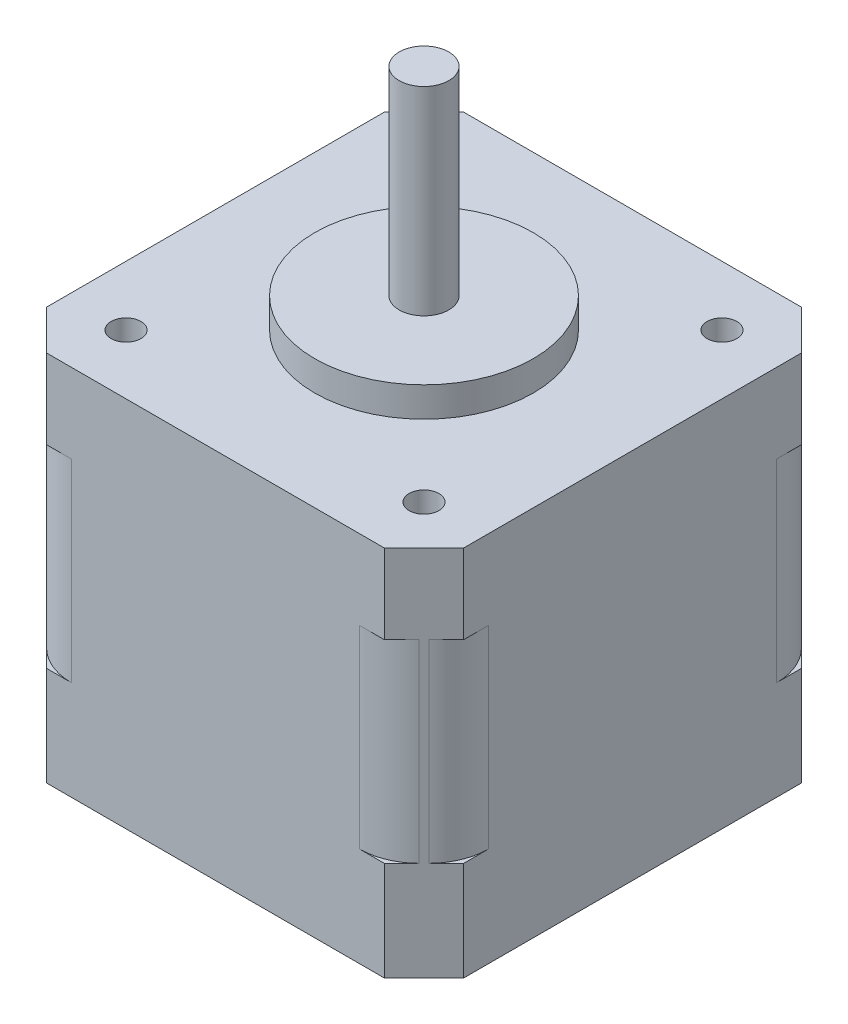
from build123d import *

# Parameters (mm, degrees)
SKETCH1_W           = 42
SKETCH1_H           = 42
BOSS_EXTRUDE1_DEPTH = 37.5
SKETCH2_R           = 2.5
BOSS_EXTRUDE2_DEPTH = 23
SKETCH3_R           = 1.5
CUT_EXTRUDE1_DEPTH  = 8
SKETCH4_R           = 11
BOSS_EXTRUDE3_DEPTH = 3
CHAMFER1_SIZE       = 4
SKETCH5_W           = 18
SKETCH5_H           = 10
BOSS_EXTRUDE4_DEPTH = 6
FILLET1_START       = 10
FILLET1_DEPTH       = 19.5
FILLET2_START       = 10
FILLET2_DEPTH       = 19.5
FILLET3_START       = 10
FILLET3_DEPTH       = 19.5


with BuildPart() as part:
    # Sketch1 → Boss-Extrude1 (new body)
    with BuildSketch(Plane(origin=(0, 0, 0), x_dir=(1, 0, 0), z_dir=(0, 1, 0))):
        with Locations((21, 21)):
            Rectangle(SKETCH1_W, SKETCH1_H)
    extrude(amount=BOSS_EXTRUDE1_DEPTH)

    # Sketch2 → Boss-Extrude2 (add)
    with BuildSketch(Plane(origin=(0, 37.5, 0), x_dir=(1, 0, 0), z_dir=(0, 1, 0))):
        with Locations(Location((21, 21, 0), (0, 0, 90))):
            Circle(SKETCH2_R)
    extrude(amount=BOSS_EXTRUDE2_DEPTH)

    # Sketch3 → Cut-Extrude1 (cut)
    with BuildSketch(Plane(origin=(0, 37.5, 0), x_dir=(1, 0, 0), z_dir=(0, 1, 0))):
        with Locations(Location((6, 36, 0), (0, 0, 270))):
            Circle(SKETCH3_R)
        with Locations(Location((36, 36, 0), (0, 0, 270))):
            Circle(SKETCH3_R)
        with Locations(Location((36, 6, 0), (0, 0, 270))):
            Circle(SKETCH3_R)
        with Locations(Location((6, 6, 0), (0, 0, 270))):
            Circle(SKETCH3_R)
    extrude(amount=-CUT_EXTRUDE1_DEPTH, mode=Mode.SUBTRACT)

    # Sketch4 → Boss-Extrude3 (add)
    with BuildSketch(Plane(origin=(0, 37.5, 0), x_dir=(1, 0, 0), z_dir=(0, 1, 0))):
        with Locations(Location((21, 21, 0), (0, 0, 90))):
            Circle(SKETCH4_R)
    extrude(amount=BOSS_EXTRUDE3_DEPTH)

    # Chamfer1
    chamfer1_edges = [part.edges().sort_by_distance(p)[0] for p in [
        (0, 18.75, -42),
        (42, 18.75, -42),
        (42, 18.75, 0),
        (0, 18.75, 0),
    ]]
    chamfer(chamfer1_edges, length=CHAMFER1_SIZE)

    # Sketch5 → Boss-Extrude4 (add)
    with BuildSketch(Plane.ZY):
        with Locations((-21, 5)):
            Rectangle(SKETCH5_W, SKETCH5_H)
    extrude(amount=BOSS_EXTRUDE4_DEPTH)

    # Fillet1: read off the stored shape, not the designer's step
    # Fillet1 outline → Fillet1 (cut)
    with BuildSketch(Plane(origin=(0, 0, 0), x_dir=(1, 0, 0), z_dir=(0, 1, 0)).offset(FILLET1_START)):
        with BuildLine():
            ThreePointArc((42, 6.485281374), (41.543277195, 4.18918078), (40.242640687, 2.242640687))
            Line((40.242640687, 2.242640687), (42, 4))
            Line((42, 4), (42, 6.485281374))
        make_face()
        with BuildLine():
            ThreePointArc((39.757359313, 1.757359313), (37.81081922, 0.456722805), (35.514718626, 0))
            Line((35.514718626, 0), (38, 0))
            Line((38, 0), (39.757359313, 1.757359313))
        make_face()
    extrude(amount=FILLET1_DEPTH, mode=Mode.SUBTRACT)

    # Fillet2: read off the stored shape, not the designer's step
    # Fillet2 outline → Fillet2 (cut)
    with BuildSketch(Plane(origin=(0, 0, 0), x_dir=(1, 0, 0), z_dir=(0, 1, 0)).offset(FILLET2_START)):
        with BuildLine():
            ThreePointArc((35.514718626, 42), (37.81081922, 41.543277195), (39.757359313, 40.242640687))
            Line((39.757359313, 40.242640687), (38, 42))
            Line((38, 42), (35.514718626, 42))
        make_face()
        with BuildLine():
            ThreePointArc((40.242640687, 39.757359313), (41.543277195, 37.81081922), (42, 35.514718626))
            Line((42, 35.514718626), (42, 38))
            Line((42, 38), (40.242640687, 39.757359313))
        make_face()
    extrude(amount=FILLET2_DEPTH, mode=Mode.SUBTRACT)

    # Fillet3: read off the stored shape, not the designer's step
    # Fillet3 outline → Fillet3 (cut)
    with BuildSketch(Plane(origin=(0, 0, 0), x_dir=(1, 0, 0), z_dir=(0, 1, 0)).offset(FILLET3_START)):
        with BuildLine():
            ThreePointArc((6.485281374, 0), (4.18918078, 0.456722805), (2.242640687, 1.757359313))
            Line((2.242640687, 1.757359313), (4, 0))
            Line((4, 0), (6.485281374, 0))
        make_face()
        with BuildLine():
            ThreePointArc((1.757359313, 2.242640687), (0.456722805, 4.18918078), (0, 6.485281374))
            Line((0, 6.485281374), (0, 4))
            Line((0, 4), (1.757359313, 2.242640687))
        make_face()
        with BuildLine():
            ThreePointArc((0, 35.514718626), (0.456722805, 37.81081922), (1.757359313, 39.757359313))
            Line((1.757359313, 39.757359313), (0, 38))
            Line((0, 38), (0, 35.514718626))
        make_face()
        with BuildLine():
            ThreePointArc((2.242640687, 40.242640687), (4.18918078, 41.543277195), (6.485281374, 42))
            Line((6.485281374, 42), (4, 42))
            Line((4, 42), (2.242640687, 40.242640687))
        make_face()
    extrude(amount=FILLET3_DEPTH, mode=Mode.SUBTRACT)


solid = part.part
